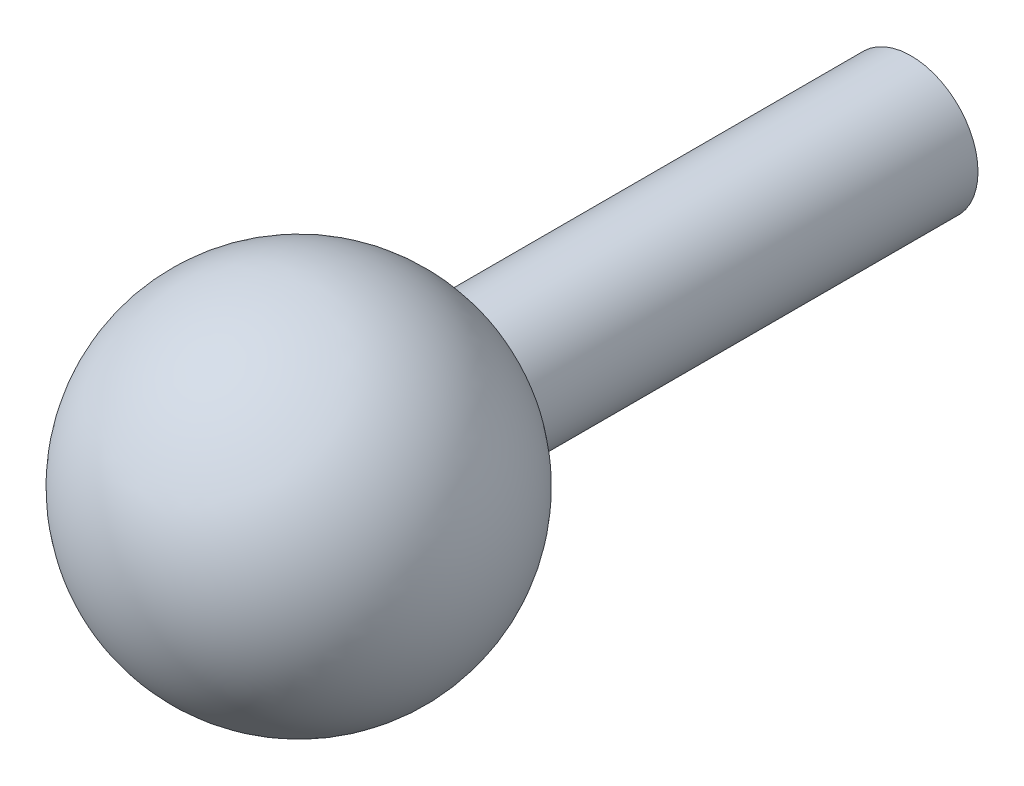
from build123d import *

# Parameters (mm, degrees)
SKETCH1_R           = 9.525
BOSS_EXTRUDE1_DEPTH = 63.5
SKETCH3_W           = 1.1
SKETCH3_H           = 2.5
CUT_EXTRUDE1_DEPTH  = 5


with BuildPart() as part:
    # Sketch1 → Boss-Extrude1 (new body)
    with BuildSketch(Plane.XY):
        Circle(SKETCH1_R)
    extrude(amount=BOSS_EXTRUDE1_DEPTH)

    # Sketch2 → Revolve1 (revolve)
    with BuildSketch(Plane(origin=(0, 0, 0), x_dir=(0, 0, -1), z_dir=(1, 0, 0))):
        with BuildLine():
            Line((-63.5, 0), (-112.446430197, 0))
            ThreePointArc((-112.446430197, 0), (-91.898268663, 24.932301608), (-63.5, 9.525))
            Line((-63.5, 9.525), (-63.5, 0))
        make_face()
    revolve(axis=Axis((0, 0, 63.5), (0, 0, 1)))

    # Sketch3 → Cut-Extrude1 (cut)
    with BuildSketch(Plane(origin=(0, 0, 0), x_dir=(-1, 0, 0), z_dir=(0, 0, -1))):
        Rectangle(SKETCH3_W, SKETCH3_H)
    extrude(amount=-CUT_EXTRUDE1_DEPTH, mode=Mode.SUBTRACT)


solid = part.part
